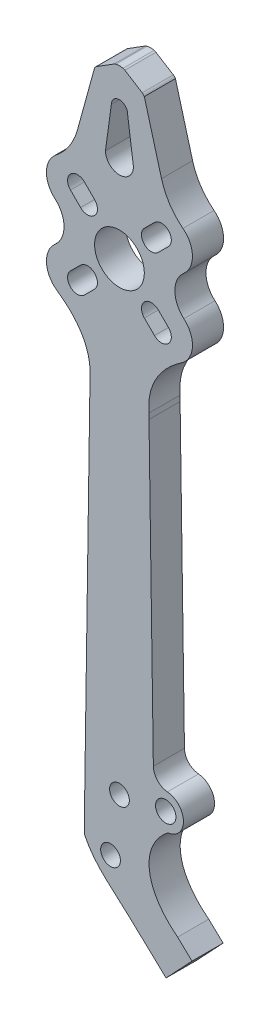
from build123d import *

# Parameters (mm, degrees)
CROQUIS1_R              = 1.590000003
CROQUIS1_R_2            = 1.5875
CROQUIS1_R_3            = 1.636695273
SALIENTE_EXTRUIR1_DEPTH = 5


with BuildPart() as part:
    # Croquis1 → Saliente-Extruir1 (new body)
    with BuildSketch(Plane.XY):
        with BuildLine():
            ThreePointArc((0.575431621, 26.806598055), (0.289790201, 26.858453506), (0, 26.875821539))
            ThreePointArc((0, 26.875821539), (-0.289790201, 26.858453506), (-0.575431621, 26.806598055))
            ThreePointArc((-0.575431621, 26.806598055), (-0.726756088, 26.756581913), (-0.868212659, 26.683160204))
            Line((-0.868212659, 26.683160204), (-3.655582473, 24.941297879))
            ThreePointArc((-3.655582473, 24.941297879), (-3.850805823, 24.781837219), (-3.999952041, 24.578624857))
            Line((-3.999952041, 24.578624857), (-6.759600821, 14.534111339))
            ThreePointArc((-6.759600821, 14.534111339), (-8.069386564, 11.655007451), (-10.212860864, 9.329003191))
            Line((-10.212860864, 9.329003191), (-10.213051715, 9.328852796))
            ThreePointArc((-10.213051715, 9.328852796), (-11.736097249, 6.280434064), (-10.356800654, 3.164336284))
            ThreePointArc((-10.356800654, 3.164336284), (-8.911806366, 0), (-10.356800654, -3.164336284))
            ThreePointArc((-10.356800654, -3.164336284), (-11.730778796, -6.413465762), (-9.998574535, -9.48659555))
            add(Edge.make_bspline(
                [(-4.75, -19.102398031), (-4.354825004, -14.738479929), (-6.980177997, -11.541798515), (-9.998574535, -9.48659555)],
                knots=[0, 0, 0, 0, 1, 1, 1, 1], degree=3))
            Line((-4.75, -19.102398031), (-4.75, -20))
            Line((-4.75, -20), (-5.626230736, -80))
            Line((-5.626230736, -80), (-5.626230736, -82.958659211))
            add(Edge.make_bspline(
                [(-5.626230736, -82.958659211), (-3.957996586, -86.469029482), (-0.996615353, -88.367748324), (1.661175244, -90.917435827)],
                knots=[0, 0, 0, 0, 0.775055833, 0.775055833, 0.775055833, 0.775055833], degree=3))
            Line((1.661175244, -90.917435827), (1.913295286, -91.154627001))
            Line((1.913295286, -91.154627001), (6.452665208, -95.425205699))
            Line((6.452665208, -95.425205699), (7.381677052, -96.299207655))
            Line((7.381677052, -96.299207655), (7.490928303, -96.401989775))
            Line((7.490928303, -96.401989775), (11.668368863, -91.961620128))
            Line((11.668368863, -91.961620128), (11.559117612, -91.858838008))
            Line((11.559117612, -91.858838008), (9.346047089, -89.776810767))
            add(Edge.make_bspline(
                [(9.346047089, -89.776810767), (3.578873833, -85.268792148), (3.467630213, -79.387038153), (7.794935908, -76.043739981)],
                knots=[0, 0, 0, 0, 1, 1, 1, 1], degree=3))
            ThreePointArc((7.794935908, -76.043739981), (10.291217665, -73.174120934), (7.712203381, -70.378620727))
            ThreePointArc((7.712203381, -70.378620727), (6.112160878, -69.585108334), (5.449910149, -67.926427563))
            Line((5.449910149, -67.926427563), (4.75, -20))
            Line((4.75, -20), (4.75, -19.102398031))
            add(Edge.make_bspline(
                [(4.75, -19.102398031), (4.354825004, -14.738479929), (6.980177997, -11.541798515), (9.998574535, -9.48659555)],
                knots=[0, 0, 0, 0, 1, 1, 1, 1], degree=3))
            ThreePointArc((9.998574535, -9.48659555), (11.730778796, -6.413465762), (10.356800654, -3.164336284))
            ThreePointArc((10.356800654, -3.164336284), (8.911806366, 0), (10.356800654, 3.164336284))
            ThreePointArc((10.356800654, 3.164336284), (11.736094415, 6.280555524), (10.212860864, 9.329003191))
            ThreePointArc((10.212860864, 9.329003191), (8.069386564, 11.655007451), (6.759600821, 14.534111339))
            Line((6.759600821, 14.534111339), (3.999952041, 24.578624857))
            ThreePointArc((3.999952041, 24.578624857), (3.850805823, 24.781837219), (3.655582473, 24.941297879))
            Line((3.655582473, 24.941297879), (0.868212659, 26.683160204))
            ThreePointArc((0.868212659, 26.683160204), (0.726756088, 26.756581913), (0.575431621, 26.806598055))
        make_face()
        with Locations((-1.433916555, -83.744346045)):
            Circle(CROQUIS1_R, mode=Mode.SUBTRACT)
        with Locations((0, -74.626706873)):
            Circle(CROQUIS1_R_2, mode=Mode.SUBTRACT)
        with Locations((7.44152153, -73.215737457)):
            Circle(CROQUIS1_R_3, mode=Mode.SUBTRACT)
        with BuildLine():
            Line((-4.003992148, -6.249056179), (-5.630337745, -7.875401775))
            ThreePointArc((-5.630337745, -7.875401775), (-7.875401775, -7.875401775), (-7.875401775, -5.630337745))
            Line((-7.875401775, -5.630337745), (-6.249056179, -4.003992148))
            ThreePointArc((-6.249056179, -4.003992148), (-4.003992148, -4.003992148), (-4.003992148, -6.249056179))
        make_face(mode=Mode.SUBTRACT)
        with BuildLine():
            ThreePointArc((-7.875401775, 5.630337745), (-7.875401775, 7.875401775), (-5.630337745, 7.875401775))
            Line((-5.630337745, 7.875401775), (-4.003992148, 6.249056179))
            ThreePointArc((-4.003992148, 6.249056179), (-4.003992148, 4.003992148), (-6.249056179, 4.003992148))
            Line((-6.249056179, 4.003992148), (-7.875401775, 5.630337745))
        make_face(mode=Mode.SUBTRACT)
        with BuildLine():
            ThreePointArc((7.875401775, -5.630337745), (7.875401775, -7.875401775), (5.630337745, -7.875401775))
            Line((5.630337745, -7.875401775), (4.003992148, -6.249056179))
            ThreePointArc((4.003992148, -6.249056179), (4.003992148, -4.003992148), (6.249056179, -4.003992148))
            Line((6.249056179, -4.003992148), (7.875401775, -5.630337745))
        make_face(mode=Mode.SUBTRACT)
        with BuildLine():
            ThreePointArc((0.151601996, 3.997126072), (2.881528065, 2.774310006), (4, 0))
            ThreePointArc((4, 0), (-2.881528065, -2.774310006), (0.151601996, 3.997126072))
        make_face(mode=Mode.SUBTRACT)
        with BuildLine():
            ThreePointArc((2.247784017, 13.915961953), (0, 11.668177935), (-2.247784017, 13.915961953))
            Line((-2.247784017, 13.915961953), (-1.3, 20.851501258))
            ThreePointArc((-1.3, 20.851501258), (-0.919238816, 21.770740074), (0, 22.151501258))
            ThreePointArc((0, 22.151501258), (0.919238816, 21.770740074), (1.3, 20.851501258))
            Line((1.3, 20.851501258), (2.247784017, 13.915961953))
        make_face(mode=Mode.SUBTRACT)
        with BuildLine():
            Line((4.003992148, 6.249056179), (5.630337745, 7.875401775))
            ThreePointArc((5.630337745, 7.875401775), (7.875401775, 7.875401775), (7.875401775, 5.630337745))
            Line((7.875401775, 5.630337745), (6.249056179, 4.003992148))
            ThreePointArc((6.249056179, 4.003992148), (4.003992148, 4.003992148), (4.003992148, 6.249056179))
        make_face(mode=Mode.SUBTRACT)
    extrude(amount=SALIENTE_EXTRUIR1_DEPTH)


solid = part.part
